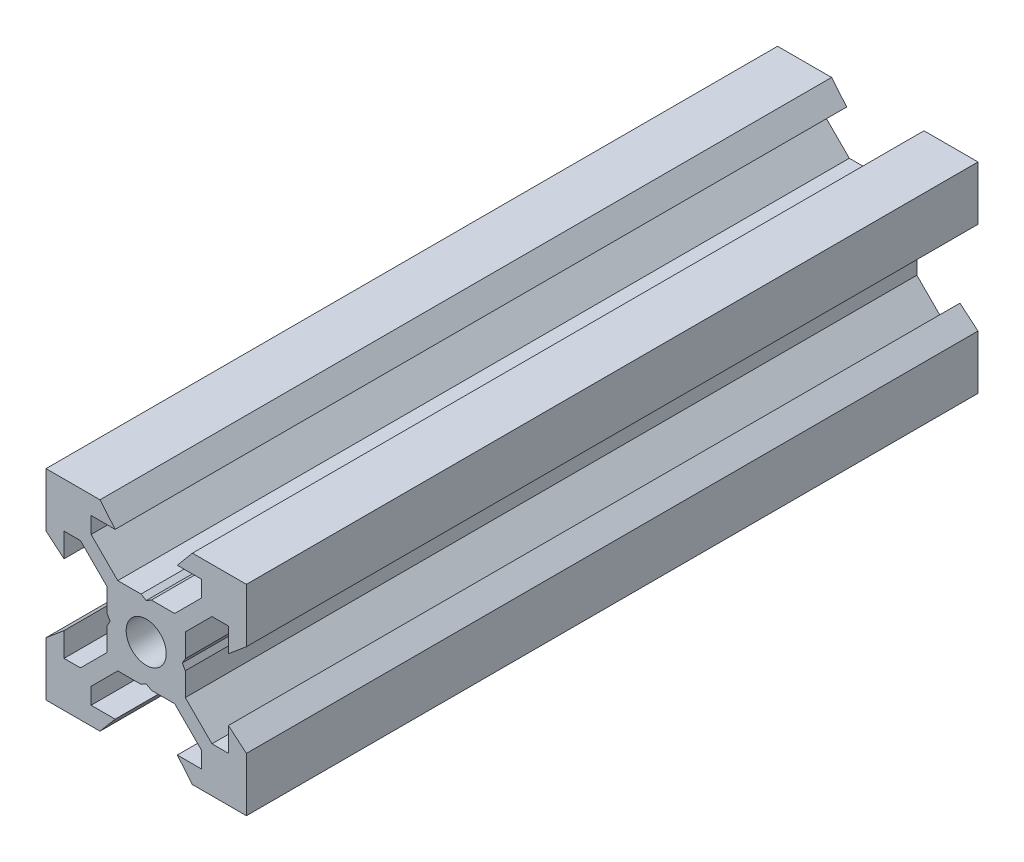
from build123d import *

# Parameters (mm, degrees)
SKETCH1_R           = 2
BOSS_EXTRUDE1_DEPTH = 36.5


with BuildPart() as part:
    # Sketch1 → Boss-Extrude1 (new, symmetric)
    with BuildSketch(Plane.XY):
        Polygon((10, 4.610379336), (10, 10), (4.610379336, 10), (3.1, 8.2), (5.5, 8.2), (5.5, 6.560660172), (2.839339828, 3.9), (0.519615242, 3.9), (0, 3.6), (-0.519615242, 3.9), (-2.839339828, 3.9), (-5.5, 6.560660172), (-5.5, 8.2), (-3.1, 8.2), (-4.610379336, 10), (-10, 10), (-10, 4.610379336), (-8.2, 3.1), (-8.2, 5.5), (-6.560660172, 5.5), (-3.9, 2.839339828), (-3.9, 0.519615242), (-3.6, 0), (-3.9, -0.519615242), (-3.9, -2.839339828), (-6.560660172, -5.5), (-8.2, -5.5), (-8.2, -3.1), (-10, -4.610379336), (-10, -10), (-4.610379336, -10), (-3.1, -8.2), (-5.5, -8.2), (-5.5, -6.560660172), (-2.839339828, -3.9), (-0.519615242, -3.9), (0, -3.6), (0.519615242, -3.9), (2.839339828, -3.9), (5.5, -6.560660172), (5.5, -8.2), (3.1, -8.2), (4.610379336, -10), (10, -10), (10, -4.610379336), (8.2, -3.1), (8.2, -5.5), (6.560660172, -5.5), (3.9, -2.839339828), (3.9, -0.519615242), (3.6, 0), (3.9, 0.519615242), (3.9, 2.839339828), (6.560660172, 5.5), (8.2, 5.5), (8.2, 3.1), align=None)
        Circle(SKETCH1_R, mode=Mode.SUBTRACT)
    extrude(amount=BOSS_EXTRUDE1_DEPTH, both=True)


solid = part.part
